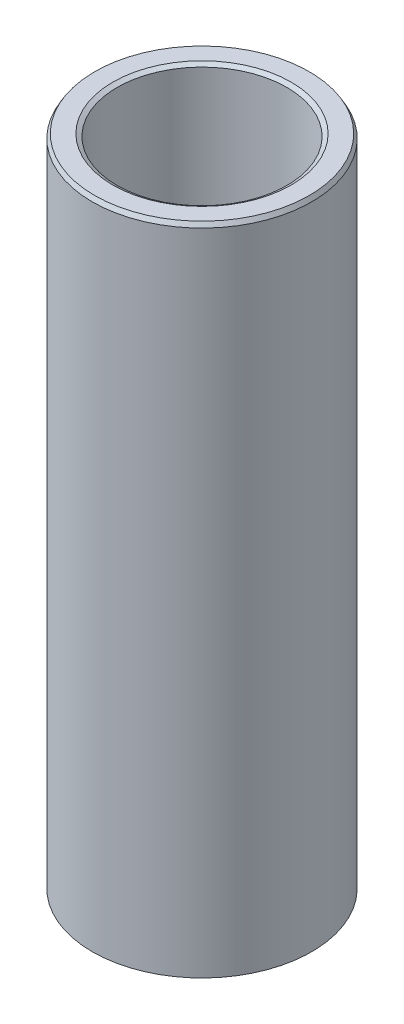
from build123d import *
from OCP.BRepFilletAPI import BRepFilletAPI_MakeChamfer

# Parameters (mm, degrees)
SKETCH1_R           = 45
BOSS_EXTRUDE1_DEPTH = 269.056557652
SKETCH2_R           = 34.83006369
CUT_EXTRUDE1_DEPTH  = 277.480435503
CHAMFER1_SIZE       = 1.742209603
CHAMFER1_SIZE2      = 1.005865183


with BuildPart() as part:
    # Sketch1 → Boss-Extrude1 (new body)
    with BuildSketch(Plane(origin=(0, 0, 0), x_dir=(1, 0, 0), z_dir=(0, 1, 0))):
        Circle(SKETCH1_R)
    extrude(amount=BOSS_EXTRUDE1_DEPTH)

    # Sketch2 → Cut-Extrude1 (cut, through all)
    with BuildSketch(Plane(origin=(0, 0, 0), x_dir=(1, 0, 0), z_dir=(0, 1, 0))):
        Circle(SKETCH2_R)
    extrude(amount=CUT_EXTRUDE1_DEPTH, mode=Mode.SUBTRACT)

    # Chamfer1: one chamfer whose edges measure the first distance from different faces: ONE call of the kernel's chamfer builder (chamfer() names one face for all edges)
    chamfer1_edges_1 = [part.edges().sort_by_distance(p)[0] for p in [
        (-34.83006369, 269.056557652, 0),
    ]]
    chamfer1_side_1 = [part.faces().sort_by_distance(p)[0] for p in [
        (-43.727207794, 269.056557652, 0),
    ]]
    chamfer1_edges_2 = [part.edges().sort_by_distance(p)[0] for p in [
        (-34.83006369, 0, 0),
    ]]
    chamfer1_side_2 = [part.faces().sort_by_distance(p)[0] for p in [
        (-34.83006369, 134.528278826, 0),
    ]]
    chamfer1_edges_3 = [part.edges().sort_by_distance(p)[0] for p in [
        (-45, 0, 0),
    ]]
    chamfer1_side_3 = [part.faces().sort_by_distance(p)[0] for p in [
        (-43.727207794, 0, 0),
    ]]
    chamfer1_edges_4 = [part.edges().sort_by_distance(p)[0] for p in [
        (-45, 269.056557652, 0),
    ]]
    chamfer1_side_4 = [part.faces().sort_by_distance(p)[0] for p in [
        (-45, 134.528278826, 0),
    ]]
    chamfer1 = BRepFilletAPI_MakeChamfer(part.part.solid().wrapped)
    for e in chamfer1_edges_1:
        chamfer1.Add(CHAMFER1_SIZE, CHAMFER1_SIZE2, e.wrapped, chamfer1_side_1[0].wrapped)  # the first distance lies on this face
    for e in chamfer1_edges_2:
        chamfer1.Add(CHAMFER1_SIZE, CHAMFER1_SIZE2, e.wrapped, chamfer1_side_2[0].wrapped)  # the first distance lies on this face
    for e in chamfer1_edges_3:
        chamfer1.Add(CHAMFER1_SIZE, CHAMFER1_SIZE2, e.wrapped, chamfer1_side_3[0].wrapped)  # the first distance lies on this face
    for e in chamfer1_edges_4:
        chamfer1.Add(CHAMFER1_SIZE, CHAMFER1_SIZE2, e.wrapped, chamfer1_side_4[0].wrapped)  # the first distance lies on this face
    add(Compound.cast(chamfer1.Shape()), mode=Mode.REPLACE)


solid = part.part
